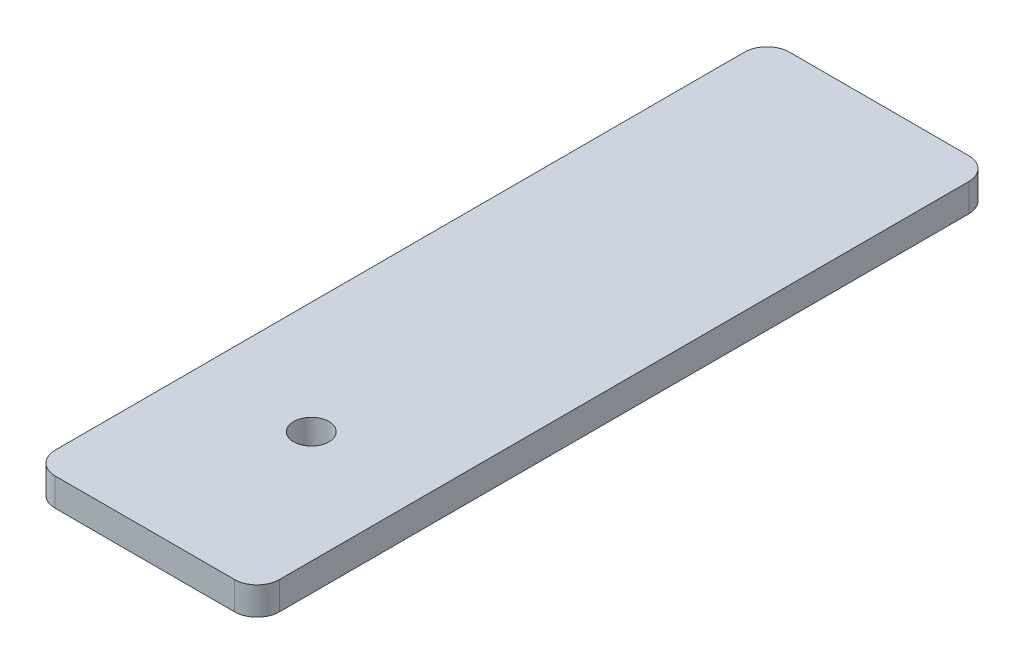
from build123d import *

# Parameters (mm, degrees)
SKETCH1_W           = 25.4
SKETCH1_H           = 83.175
BOSS_EXTRUDE1_DEPTH = 3.175
SKETCH2_R           = 2
CUT_EXTRUDE1_DEPTH  = 63.137257853
FILLET1_R           = 2.54


with BuildPart() as part:
    # Sketch1 → Boss-Extrude1 (new body)
    with BuildSketch(Plane(origin=(0, 0, 0), x_dir=(1, 0, 0), z_dir=(0, 1, 0))):
        with Locations((-13.581081081, 14.628716216)):
            Rectangle(SKETCH1_W, SKETCH1_H)
    extrude(amount=BOSS_EXTRUDE1_DEPTH)

    # Sketch2 → Cut-Extrude1 (cut, through all)
    with BuildSketch(Plane(origin=(0, 3.175, 0), x_dir=(1, 0, 0), z_dir=(0, 1, 0))):
        with Locations((-13.581081081, -8.108783784)):
            Circle(SKETCH2_R)
    extrude(amount=-CUT_EXTRUDE1_DEPTH, mode=Mode.SUBTRACT)

    # Fillet1
    fillet1_edges = [part.edges().sort_by_distance(p)[0] for p in [
        (-26.281081081, 1.5875, -56.216216216),
        (-0.881081081, 1.5875, -56.216216216),
        (-0.881081081, 1.5875, 26.958783784),
        (-26.281081081, 1.5875, 26.958783784),
    ]]
    fillet(fillet1_edges, radius=FILLET1_R)


solid = part.part
